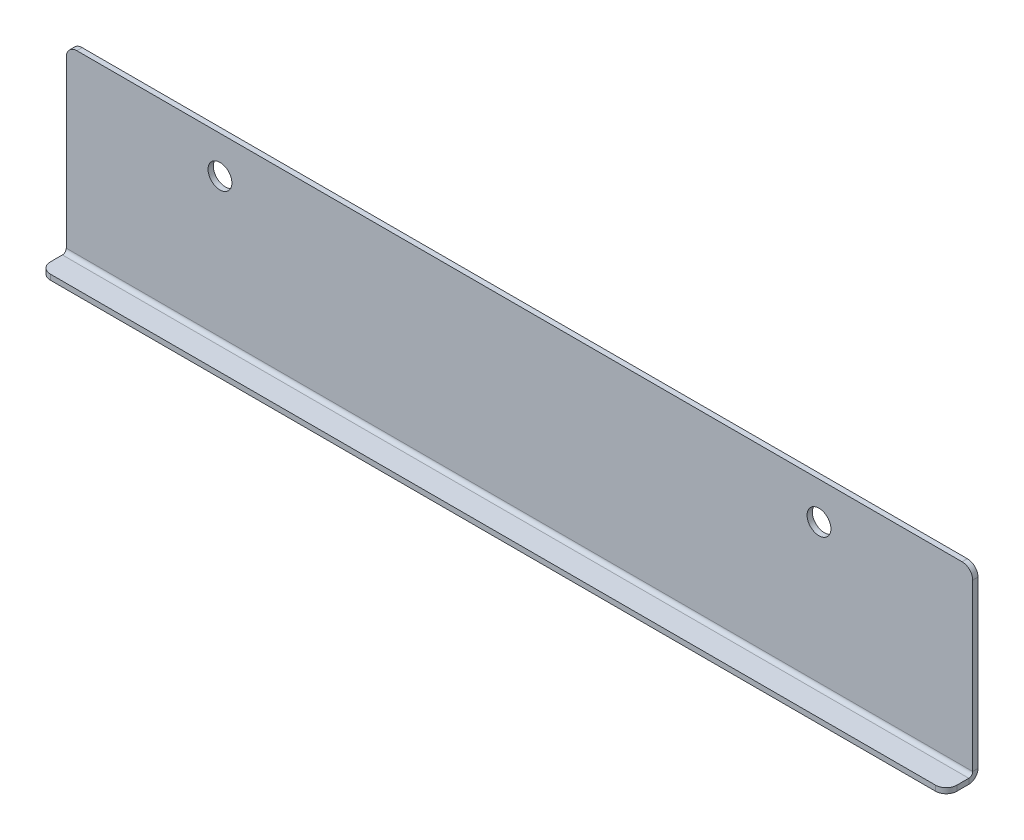
from build123d import *

# Parameters (mm, degrees)
ESQUISSE1_W                           = 171
ESQUISSE1_H                           = 34
ESQUISSE1_R                           = 2.25
T_LE_DE_BASE_PLI_E1_DEPTH             = 1
T_LE_PLI_E_SUR_AR_TE1_STRIP_W         = 5.4732
T_LE_PLI_E_SUR_AR_TE1_STRIP_H         = 1
T_LE_PLI_E_SUR_AR_TE1_STRIP_CUT_DEPTH = 171
T_LE_PLI_E_SUR_AR_TE1_DEPTH           = 171
CONG_1_R                              = 2


# Sheet-metal steps are written as plain solids
with BuildPart() as part:
    # Esquisse1 → Tôle de base pliée1 (new body)
    with BuildSketch(Plane.XY):
        with Locations((0, -3)):
            Rectangle(ESQUISSE1_W, ESQUISSE1_H)
        with Locations((-56.5, 7)):
            Circle(ESQUISSE1_R, mode=Mode.SUBTRACT)
        with Locations(Location((56.5, 7, 0), (0, 0, 180))):
            Circle(ESQUISSE1_R, mode=Mode.SUBTRACT)
    extrude(amount=-T_LE_DE_BASE_PLI_E1_DEPTH)

    # Tôle pliée sur arête1 strip (across the edge) → Tôle pliée sur arête1 strip cut (cut)
    with BuildSketch(Plane(origin=(-85.5, -20, 0), x_dir=(0, 1, 0), z_dir=(1, 0, 0))):
        with Locations((-2, -0.5)):
            Rectangle(T_LE_PLI_E_SUR_AR_TE1_STRIP_W, T_LE_PLI_E_SUR_AR_TE1_STRIP_H)
    extrude(amount=T_LE_PLI_E_SUR_AR_TE1_STRIP_CUT_DEPTH, mode=Mode.SUBTRACT)

    # Tôle pliée sur arête1 section (across the edge) → Tôle pliée sur arête1 (add)
    with BuildSketch(Plane(origin=(-85.5, -20, 0), x_dir=(0, 1, 0), z_dir=(1, 0, 0))):
        with BuildLine():
            Line((-1, 0.7366), (-1, 5))
            Line((-1, 5), (0, 5))
            Line((0, 5), (0, 0.7366))
            ThreePointArc((0, 0.7366), (0.215745145, 0.215745145), (0.7366, 0))
            Line((0.7366, 0), (0.7366, -1))
            ThreePointArc((0.7366, -1), (-0.491361636, -0.491361636), (-1, 0.7366))
        make_face()
    extrude(amount=T_LE_PLI_E_SUR_AR_TE1_DEPTH)

    # Congé1
    cong_1_edges = [part.edges().sort_by_distance(p)[0] for p in [
        (-85.5, -20.5, 5),
        (85.5, -20.5, 5),
        (-85.5, 14, -0.5),
        (85.5, 14, -0.5),
    ]]
    fillet(cong_1_edges, radius=CONG_1_R)


solid = part.part
